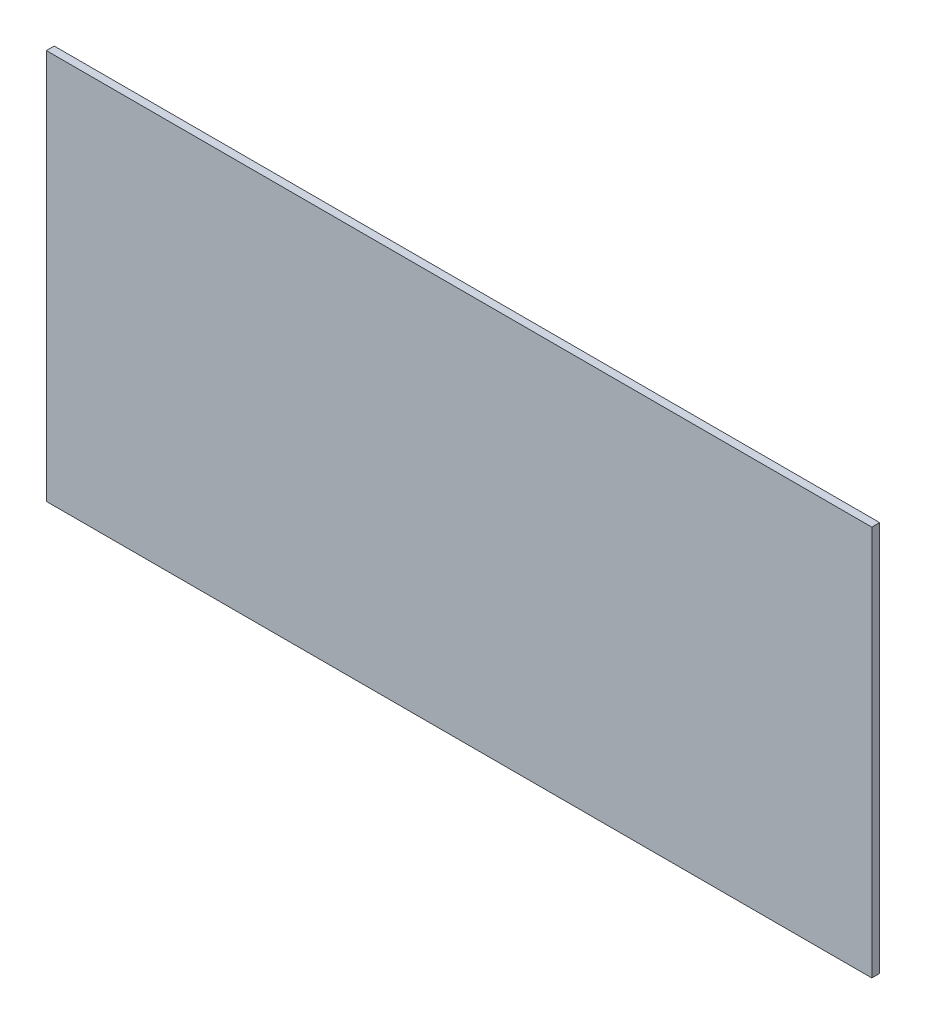
from build123d import *

# Parameters (mm, degrees)
IZIM1_W            = 630
IZIM1_H            = 298
TABAN_FLAN_1_DEPTH = 6


# Sheet-metal steps are written as plain solids
with BuildPart() as part:
    # Çizim1 → Taban-Flanş1 (new body)
    with BuildSketch(Plane.XY):
        with Locations((315, -149)):
            Rectangle(IZIM1_W, IZIM1_H)
    extrude(amount=-TABAN_FLAN_1_DEPTH)


solid = part.part
